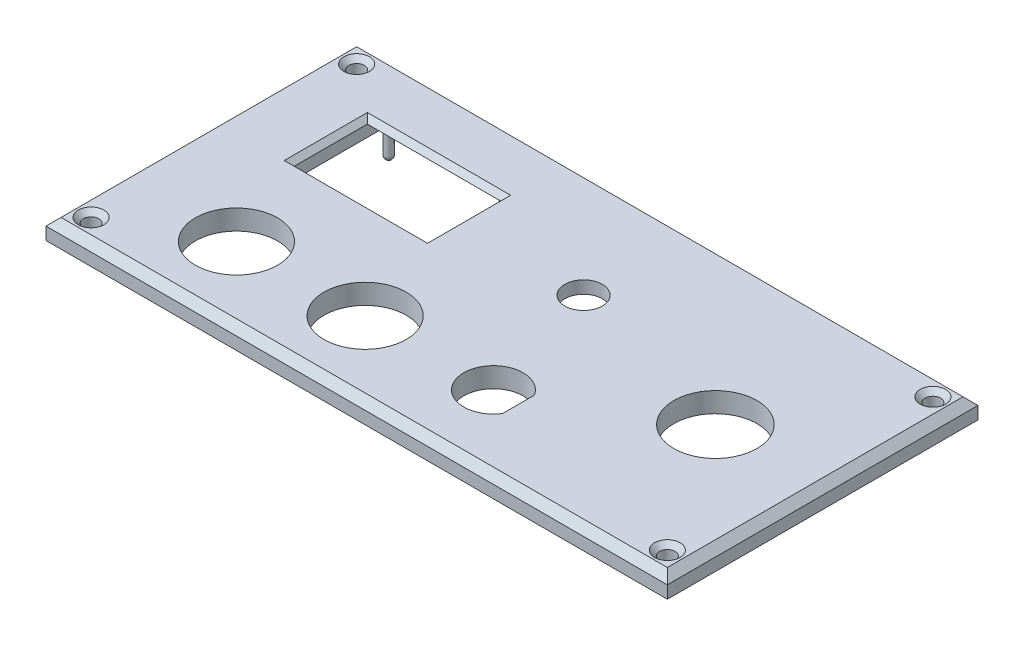
from build123d import *

# Parameters (mm, degrees)
SKETCH2_W           = 124
SKETCH2_H           = 62
SKETCH2_R           = 1.55
SKETCH2_W_2         = 26.6
SKETCH2_H_2         = 14.6
SKETCH2_R_2         = 3.75
SKETCH2_R_3         = 8.3
SKETCH2_R_4         = 8.2
BOSS_EXTRUDE1_DEPTH = 4
CHAMFER1_SIZE       = 1.5
CHAMFER2_SIZE       = 1
SKETCH2_3_R         = 0.8
BOSS_EXTRUDE2_DEPTH = 3.5
FILLET1_R           = 0.8
CUT_EXTRUDE1_START  = 3
SKETCH2_4_W         = 28
SKETCH2_4_H         = 28.35
SKETCH2_4_R         = 0.8
SKETCH2_4_W_2       = 26.6
SKETCH2_4_H_2       = 14.6
CUT_EXTRUDE1_DEPTH  = 3
CHAMFER3_SIZE       = 1
SKETCH2_5_W         = 13.2
SKETCH2_5_H         = 14
CUT_EXTRUDE4_DEPTH  = 1.5


with BuildPart() as part:
    # Sketch2 → Boss-Extrude1 (new body)
    with BuildSketch(Plane(origin=(0, 0, 0), x_dir=(1, 0, 0), z_dir=(0, 1, 0))):
        with Locations((62, 31)):
            Rectangle(SKETCH2_W, SKETCH2_H)
        with Locations(Location((4.5, 4.5, 0), (0, 0, 270))):
            Circle(SKETCH2_R, mode=Mode.SUBTRACT)
        with Locations(Location((119.5, 4.5, 0), (0, 0, 270))):
            Circle(SKETCH2_R, mode=Mode.SUBTRACT)
        with Locations((28.239743387, 41.89740921)):
            Rectangle(SKETCH2_W_2, SKETCH2_H_2, mode=Mode.SUBTRACT)
        with Locations(Location((4.5, 57.5, 0), (0, 0, 270))):
            Circle(SKETCH2_R, mode=Mode.SUBTRACT)
        with Locations(Location((67.078277823, 40.203161161, 0), (0, 0, 270))):
            Circle(SKETCH2_R_2, mode=Mode.SUBTRACT)
        with Locations(Location((119.5, 57.5, 0), (0, 0, 270))):
            Circle(SKETCH2_R, mode=Mode.SUBTRACT)
        with Locations(Location((102.593331931, 31, 0), (0, 0, 270))):
            Circle(SKETCH2_R_3, mode=Mode.SUBTRACT)
        with BuildLine():
            ThreePointArc((79.454234541, 11.660627935), (68.529234541, 14.839562505), (79.454234541, 18.018497075))
            Line((79.454234541, 18.018497075), (79.454234541, 11.660627935))
        make_face(mode=Mode.SUBTRACT)
        with Locations(Location((48.846547615, 14.839562505, 0), (0, 0, 270))):
            Circle(SKETCH2_R_4, mode=Mode.SUBTRACT)
        with Locations(Location((23.171087178, 14.839562505, 0), (0, 0, 270))):
            Circle(SKETCH2_R_4, mode=Mode.SUBTRACT)
    extrude(amount=BOSS_EXTRUDE1_DEPTH)

    # Chamfer1
    chamfer1_edges = [part.edges().sort_by_distance(p)[0] for p in [
        (62, 4, 0),
        (124, 4, -31),
        (62, 4, -62),
        (0, 4, -31),
    ]]
    chamfer(chamfer1_edges, length=CHAMFER1_SIZE)

    # Chamfer2
    chamfer2_edges = [part.edges().sort_by_distance(p)[0] for p in [
        (119.5, 0, -59.05),
        (4.5, 4, -6.05),
        (119.5, 4, -59.05),
        (119.5, 4, -6.05),
        (4.5, 4, -59.05),
    ]]
    chamfer(chamfer2_edges, length=CHAMFER2_SIZE)

    # Sketch2<3> → Boss-Extrude2 (add)
    with BuildSketch(Plane(origin=(0, 0, 0), x_dir=(1, 0, 0), z_dir=(0, 1, 0))):
        with Locations(Location((16.679743387, 28.409287577, 0), (0, 0, 270))):
            Circle(SKETCH2_3_R)
        with Locations(Location((16.679743387, 51.709287577, 0), (0, 0, 270))):
            Circle(SKETCH2_3_R)
        with Locations(Location((39.799743387, 28.409287577, 0), (0, 0, 270))):
            Circle(SKETCH2_3_R)
        with Locations(Location((39.799743387, 51.709287577, 0), (0, 0, 270))):
            Circle(SKETCH2_3_R)
    extrude(amount=-BOSS_EXTRUDE2_DEPTH)

    # Fillet1
    fillet1_edges = [part.edges().sort_by_distance(p)[0] for p in [
        (39.799743387, -3.5, -29.209287577),
        (39.799743387, -3.5, -52.509287577),
        (16.679743387, -3.5, -29.209287577),
        (16.679743387, -3.5, -52.509287577),
    ]]
    fillet(fillet1_edges, radius=FILLET1_R)

    # Sketch2<4> → Cut-Extrude1 (cut)
    with BuildSketch(Plane(origin=(0, 0, 0), x_dir=(1, 0, 0), z_dir=(0, 1, 0)).offset(CUT_EXTRUDE1_START)):
        with Locations((28.239743387, 39.62240921)):
            Rectangle(SKETCH2_4_W, SKETCH2_4_H)
        with Locations(Location((16.679743387, 51.709287577, 0), (0, 0, 270))):
            Circle(SKETCH2_4_R, mode=Mode.SUBTRACT)
        with Locations(Location((16.679743387, 28.409287577, 0), (0, 0, 270))):
            Circle(SKETCH2_4_R, mode=Mode.SUBTRACT)
        with Locations(Location((39.799743387, 28.409287577, 0), (0, 0, 270))):
            Circle(SKETCH2_4_R, mode=Mode.SUBTRACT)
        with Locations(Location((39.799743387, 51.709287577, 0), (0, 0, 270))):
            Circle(SKETCH2_4_R, mode=Mode.SUBTRACT)
        with Locations((28.239743387, 41.89740921)):
            Rectangle(SKETCH2_4_W_2, SKETCH2_4_H_2, mode=Mode.SUBTRACT)
    extrude(amount=-CUT_EXTRUDE1_DEPTH, mode=Mode.SUBTRACT)

    # Chamfer3
    chamfer3_edges = [part.edges().sort_by_distance(p)[0] for p in [
        (28.239743387, 4, -34.59740921),
        (41.539743387, 4, -41.89740921),
        (14.939743387, 4, -41.89740921),
        (28.239743387, 4, -49.19740921),
    ]]
    chamfer(chamfer3_edges, length=CHAMFER3_SIZE - 0.0001)  # a hair under: the kernel refuses the full size

    # Sketch2<5> → Cut-Extrude4 (cut)
    with BuildSketch(Plane(origin=(0, 0, 0), x_dir=(1, 0, 0), z_dir=(0, 1, 0))):
        with Locations((67.078277823, 40.203161161)):
            Rectangle(SKETCH2_5_W, SKETCH2_5_H)
    extrude(amount=CUT_EXTRUDE4_DEPTH, mode=Mode.SUBTRACT)


solid = part.part
